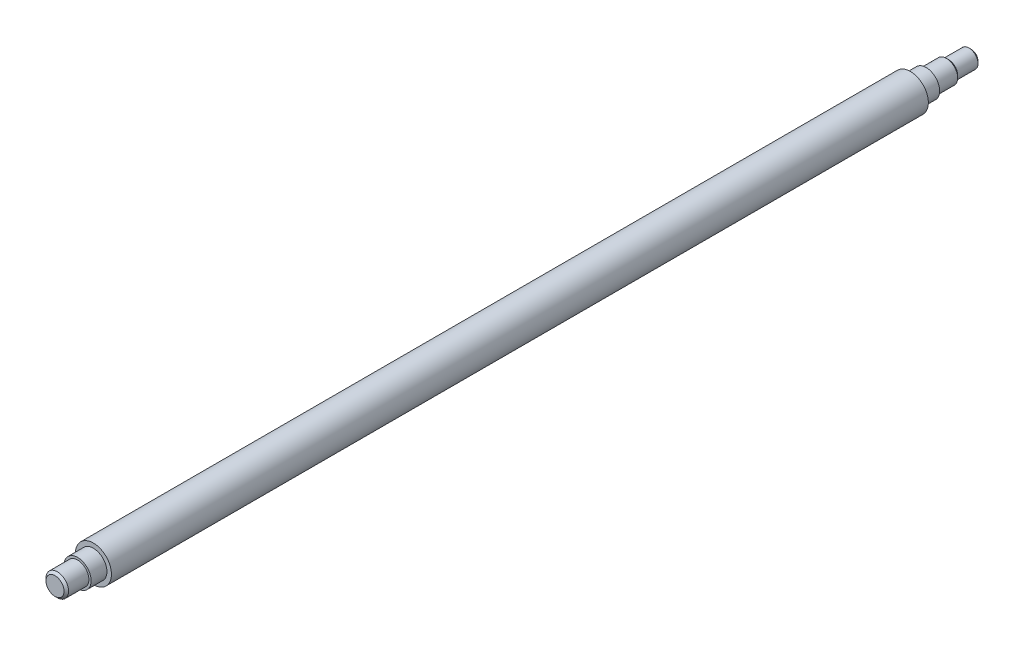
from build123d import *

# Parameters (mm, degrees)
SKETCH1_R           = 8
BOSS_EXTRUDE1_DEPTH = 362
SKETCH6_R           = 6
BOSS_EXTRUDE2_DEPTH = 5
SKETCH7_R           = 6
BOSS_EXTRUDE3_DEPTH = 2
SKETCH8_R           = 5
BOSS_EXTRUDE4_DEPTH = 10
SKETCH9_R           = 4
BOSS_EXTRUDE5_DEPTH = 10
CHAMFER1_SIZE       = 1
CHAMFER2_SIZE       = 1
BOSS_EXTRUDE6_START = 5
SKETCH10_R          = 6
BOSS_EXTRUDE6_DEPTH = 5
BOSS_EXTRUDE7_START = 2
SKETCH11_R          = 6
BOSS_EXTRUDE7_DEPTH = 2
BOSS_EXTRUDE8_START = 10
SKETCH12_R          = 5
BOSS_EXTRUDE8_DEPTH = 10
CHAMFER3_SIZE       = 1


with BuildPart() as part:
    # Sketch1 → Boss-Extrude1 (new body)
    with BuildSketch(Plane.XY):
        Circle(SKETCH1_R)
    extrude(amount=BOSS_EXTRUDE1_DEPTH)

    # Sketch6 → Boss-Extrude2 (add)
    with BuildSketch(Plane(origin=(0, 0, 0), x_dir=(-1, 0, 0), z_dir=(0, 0, -1))):
        with Locations(Location((0, 0, 0), (0, 0, 180))):
            Circle(SKETCH6_R)
    extrude(amount=BOSS_EXTRUDE2_DEPTH)

    # Sketch7 → Boss-Extrude3 (add)
    with BuildSketch(Plane(origin=(0, 0, -5), x_dir=(-1, 0, 0), z_dir=(0, 0, -1))):
        with Locations(Location((0, 0, 0), (0, 0, 180))):
            Circle(SKETCH7_R)
    extrude(amount=BOSS_EXTRUDE3_DEPTH)

    # Sketch8 → Boss-Extrude4 (add)
    with BuildSketch(Plane(origin=(0, 0, -7), x_dir=(-1, 0, 0), z_dir=(0, 0, -1))):
        Circle(SKETCH8_R)
    extrude(amount=BOSS_EXTRUDE4_DEPTH)

    # Sketch9 → Boss-Extrude5 (add)
    with BuildSketch(Plane(origin=(0, 0, -17), x_dir=(-1, 0, 0), z_dir=(0, 0, -1))):
        Circle(SKETCH9_R)
    extrude(amount=BOSS_EXTRUDE5_DEPTH)

    # Chamfer1
    chamfer1_edges = [part.edges().sort_by_distance(p)[0] for p in [
        (5, 0, -17),
    ]]
    chamfer(chamfer1_edges, length=CHAMFER1_SIZE - 0.0001)  # a hair under: the kernel refuses the full size

    # Chamfer2
    chamfer2_edges = [part.edges().sort_by_distance(p)[0] for p in [
        (4, 0, -27),
    ]]
    chamfer(chamfer2_edges, length=CHAMFER2_SIZE)

    # Sketch10 → Boss-Extrude6 (add)
    with BuildSketch(Plane.XY.offset(362).offset(BOSS_EXTRUDE6_START)):
        Circle(SKETCH10_R)
    extrude(amount=-BOSS_EXTRUDE6_DEPTH)

    # Sketch11 → Boss-Extrude7 (add)
    with BuildSketch(Plane.XY.offset(367).offset(BOSS_EXTRUDE7_START)):
        Circle(SKETCH11_R)
    extrude(amount=-BOSS_EXTRUDE7_DEPTH)

    # Sketch12 → Boss-Extrude8 (add)
    with BuildSketch(Plane.XY.offset(369).offset(BOSS_EXTRUDE8_START)):
        with Locations(Location((0, 0, 0), (0, 0, 180))):
            Circle(SKETCH12_R)
    extrude(amount=-BOSS_EXTRUDE8_DEPTH)

    # Chamfer3
    chamfer3_edges = [part.edges().sort_by_distance(p)[0] for p in [
        (5, 0, 379),
    ]]
    chamfer(chamfer3_edges, length=CHAMFER3_SIZE)


solid = part.part
